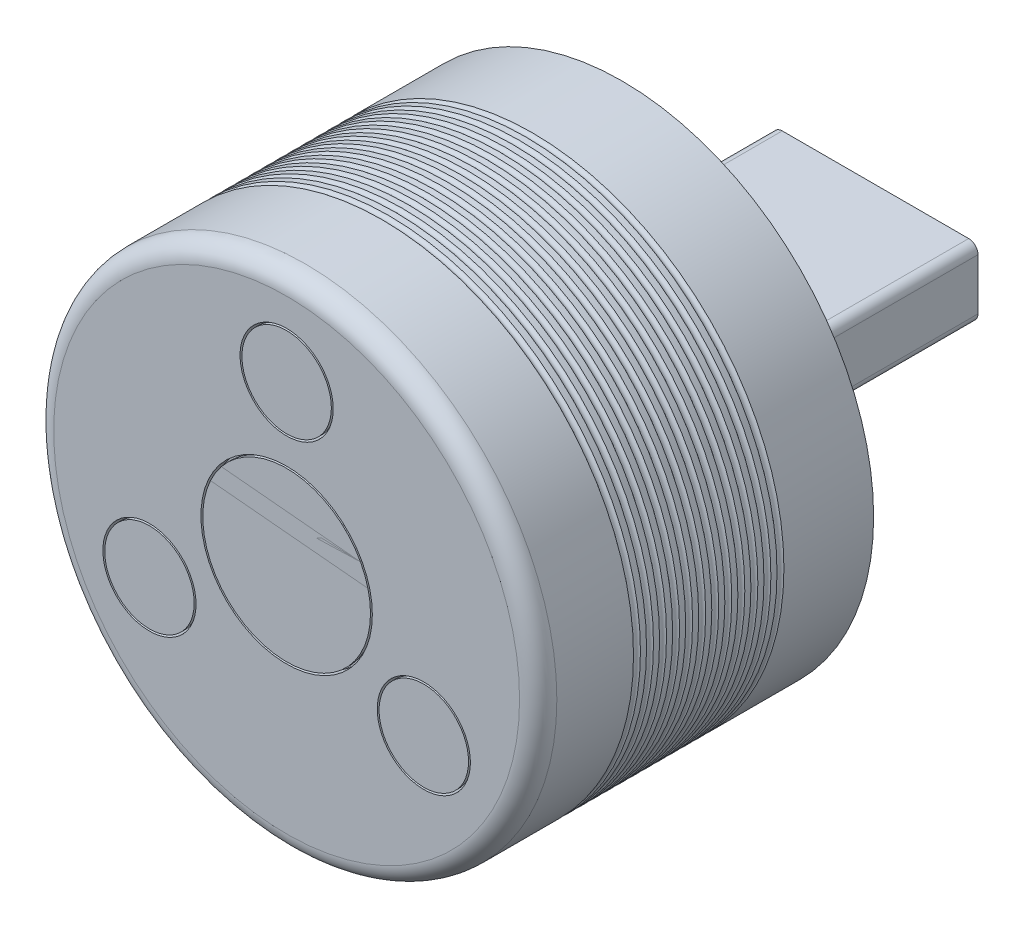
from build123d import *

# Parameters (mm, degrees)
FRONT_COVER_DEPTH                              = 15
FRONT_COVER_DEPTH_BACK                         = 3
SKETCH1_R                                      = 13.5
SKETCH2_R                                      = 2.5
ECG_HOLES_DEPTH                                = 2
SKETCH2_4_R                                    = 4.6
PRESSURE_SENSOR_HOLE_DEPTH                     = 0.5
FILLET_FRONT_COVER_R                           = 1
SHELL_START                                    = -3
SHELL_FRONT_COVER_OUTLINE_R                    = 12.5
SHELL_FRONT_COVER_OUTLINE_R_2                  = 3
SHELL_FRONT_COVER_DEPTH                        = 14.837411557
SHELL_START_2                                  = 9.598878162
SHELL_FRONT_COVER_2_OUTLINE_R                  = 12.5
SHELL_FRONT_COVER_2_DEPTH                      = 4.401121838
SHELL_FRONT_COVER_3_OUTLINE_R                  = 3
SHELL_FRONT_COVER_3_DEPTH                      = 12.598878162
SHELL_FRONT_COVER_4_OUTLINE_R                  = 3.5
SHELL_FRONT_COVER_4_DEPTH                      = 2.401121838
SHELL_START_3                                  = 11.837411557
SHELL_FRONT_COVER_5_DEPTH                      = 1.662588443
HOLES_ECG_WIRES_REACH                          = 26.91
SKETCH4_R                                      = 0.75
HOLE_PRESSURE_SENSOR_FPC_REACH                 = 27.899
SKETCH5_W                                      = 5.8
SKETCH5_H                                      = 0.5
HOLE_MIC_PINS_REACH                            = 25.44
SKETCH17_R                                     = 13.05
FRONT_COVER_FIX_STRUCTURE_DEPTH                = 1.1
SKETCH7_R                                      = 13
BACK_COVER_DEPTH                               = 1
SKETCH8_W                                      = 11
SKETCH8_H                                      = 3.75
USB_HOLE_BACK_COVER_DEPTH                      = 1
SKETCH9_R                                      = 0.2
SKETCH12_R                                     = 2.4
MOCK_FILM_SENSORS_DEPTH                        = 0.2
MOCK_FILM_SENSORS_2_DEPTH                      = 0.2
MOCK_FILM_SENSORS_3_DEPTH                      = 0.2
SKETCH12_R_2                                   = 4.5
MOCK_FILM_SENSORS_4_DEPTH                      = 0.2
SKETCH13_R                                     = 2
FRONT_COVER_SCREWS_PILLARS_DEPTH               = 14
SCREWS_PILLARS_RIBS_REACH                      = 30.767
SKETCH16_WALL_W                                = 63.534087048
SKETCH16_WALL_H                                = 1
CIRPATTERN1_COUNT                              = 4
CIRPATTERN2_COUNT                              = 3
CIRPATTERN2_COPY_1_REACH                       = 30.767
CIRPATTERN2_COPY_1_SKETCH_W                    = 63.534087048
CIRPATTERN2_COPY_1_SKETCH_H                    = 1
CIRPATTERN2_COPY_2_REACH                       = 30.767
CIRPATTERN2_COPY_2_SKETCH_W                    = 63.534087048
CIRPATTERN2_COPY_2_SKETCH_H                    = 1
CIRPATTERN2_COPY_3_REACH                       = 30.767
CIRPATTERN2_COPY_3_SKETCH_W                    = 63.534087048
CIRPATTERN2_COPY_3_SKETCH_H                    = 1
CIRPATTERN2_COPY_4_REACH                       = 30.767
CIRPATTERN2_COPY_4_SKETCH_W                    = 63.534087048
CIRPATTERN2_COPY_4_SKETCH_H                    = 1
CIRPATTERN2_COPY_5_REACH                       = 30.767
CIRPATTERN2_COPY_5_SKETCH_W                    = 63.534087048
CIRPATTERN2_COPY_5_SKETCH_H                    = 1
CIRPATTERN2_COPY_6_REACH                       = 30.767
CIRPATTERN2_COPY_6_SKETCH_W                    = 63.534087048
CIRPATTERN2_COPY_6_SKETCH_H                    = 1
SKETCH18_R                                     = 3
USB_BASE_DEPTH                                 = 4.1
BACK_START                                     = 4.1
SKETCH18_3_R                                   = 2.1
BACK_COVER_SCREWS_FEMALE_PILLARS_DEPTH         = 2.2
SKETCH23_R                                     = 0.3
SKETCH23_W                                     = 1.9
SKETCH23_H                                     = 1.5
BACK_COVER_SCREWS_FEMALE_PILLARS_FIX_HOL_DEPTH = 0.7
USB_START                                      = 11
SKETCH23_2_R                                   = 0.3
SKETCH23_2_W                                   = 1.9
SKETCH23_2_H                                   = 1.5
USB_FIX_STRUCTURE_BACK_COVER_DEPTH             = 0.7
FILLET_USB_FIX_R                               = 0.2
BACK_COVER_SCREWS_FEMALE_PILLARS_SCR_2_COUNT   = 2
BACK_COVER_SCREWS_FEMALE_PILLARS_SCR_2_PITCH   = 15.159615379
BACK_COVER_SCREWS_FEMALE_PILLARS_SCR_3_COUNT   = 2
BACK_COVER_SCREWS_FEMALE_PILLARS_SCR_3_PITCH   = 15.159615379
MOCK_USB_METAL_DEPTH                           = 13.6
SKETCH26_R                                     = 4.5
BOSS_EXTRUDE11_DEPTH                           = 0.2
SKETCH27_W                                     = 8
SKETCH27_H                                     = 1
MOCK_USB_STICK_DEPTH                           = 14.6
SKETCH28_W                                     = 1
SKETCH28_H                                     = 0.1
MOCK_USB_PINS_DEPTH                            = 10
MOCK_USB_PINS_2_DEPTH                          = 10
MOCK_USB_PINS_3_DEPTH                          = 10
MOCK_USB_PINS_4_DEPTH                          = 10
MOCK_USB_PINS_5_DEPTH                          = 10
MOCK_USB_PINS_6_DEPTH                          = 10
MOCK_USB_PINS_7_DEPTH                          = 10
MOCK_USB_PINS_8_DEPTH                          = 10
MOCK_USB_PINS_9_DEPTH                          = 10


with BuildPart() as part:
    # Sketch1 → front cover (new, two sides: drawn at the far end of the back side and taken through both)
    with BuildSketch(Plane.XY.offset(-FRONT_COVER_DEPTH_BACK)):
        Circle(SKETCH1_R)
    extrude(amount=FRONT_COVER_DEPTH + FRONT_COVER_DEPTH_BACK)

    # Sketch2 → ECG holes (cut)
    with BuildSketch(Plane.XY.offset(15)):
        with Locations((7.361215932, -4.25)):
            Circle(SKETCH2_R)
        with Locations((0, 8.5)):
            Circle(SKETCH2_R)
        with Locations((-7.361215932, -4.25)):
            Circle(SKETCH2_R)
    extrude(amount=-ECG_HOLES_DEPTH, mode=Mode.SUBTRACT)

    # Sketch2<4> → pressure sensor hole (cut)
    with BuildSketch(Plane.XY.offset(15)):
        Circle(SKETCH2_4_R)
    extrude(amount=-PRESSURE_SENSOR_HOLE_DEPTH, mode=Mode.SUBTRACT)

    # Sketch3 → cavity mic (revolve, cut)
    with BuildSketch(Plane(origin=(0, 0, 0), x_dir=(1, 0, 0), z_dir=(0, 1, 0))):
        with BuildLine():
            Line((0, -10.598878162), (0, -14.503714756))
            Line((0, -14.503714756), (2.7, -14.501534356))
            ThreePointArc((2.7, -14.501534356), (2.502749431, -13.255703595), (2, -12.098878162))
            Line((2, -12.098878162), (2, -10.598878162))
            Line((2, -10.598878162), (0, -10.598878162))
        make_face()
    revolve(axis=Axis((0, 0, 10.598878162), (0, 0, 1)), mode=Mode.SUBTRACT)

    # fillet front cover
    fillet_front_cover_edges = [part.edges().sort_by_distance(p)[0] for p in [
        (-13.5, 0, 15),
    ]]
    fillet(fillet_front_cover_edges, radius=FILLET_FRONT_COVER_R)

    # Shell front cover: read off the stored shape, not the designer's step
    # Shell front cover outline → Shell front cover (cut)
    with BuildSketch(Plane.XY.offset(SHELL_START)):
        Circle(SHELL_FRONT_COVER_OUTLINE_R)
        Circle(SHELL_FRONT_COVER_OUTLINE_R_2, mode=Mode.SUBTRACT)
    extrude(amount=SHELL_FRONT_COVER_DEPTH, mode=Mode.SUBTRACT)

    # Shell front cover 2 outline → Shell front cover 2 (cut)
    with BuildSketch(Plane.XY.offset(SHELL_START_2)):
        Circle(SHELL_FRONT_COVER_2_OUTLINE_R)
        with BuildLine():
            ThreePointArc((5.44134212, -1.323554281), (10.392304845, -6), (3.866902691, -4.050563366))
            ThreePointArc((3.866902691, -4.050563366), (0, -5.6), (-3.866902691, -4.050563366))
            ThreePointArc((-3.866902691, -4.050563366), (-10.392304845, -6), (-5.44134212, -1.323554281))
            ThreePointArc((-5.44134212, -1.323554281), (-4.849742261, 2.8), (-1.574439429, 5.374117647))
            ThreePointArc((-1.574439429, 5.374117647), (0, 12), (1.574439429, 5.374117647))
            ThreePointArc((1.574439429, 5.374117647), (4.849742261, 2.8), (5.44134212, -1.323554281))
        make_face(mode=Mode.SUBTRACT)
    extrude(amount=SHELL_FRONT_COVER_2_DEPTH, mode=Mode.SUBTRACT)

    # Shell front cover 3 outline → Shell front cover 3 (cut)
    with BuildSketch(Plane.XY.offset(SHELL_START)):
        Circle(SHELL_FRONT_COVER_3_OUTLINE_R)
    extrude(amount=SHELL_FRONT_COVER_3_DEPTH, mode=Mode.SUBTRACT)

    # Shell front cover 4 outline → Shell front cover 4 (cut)
    with BuildSketch(Plane.XY.offset(SHELL_START_2)):
        with Locations((7.361215932, -4.25)):
            Circle(SHELL_FRONT_COVER_4_OUTLINE_R)
        with Locations((0, 8.5)):
            Circle(SHELL_FRONT_COVER_4_OUTLINE_R)
        with Locations((-7.361215932, -4.25)):
            Circle(SHELL_FRONT_COVER_4_OUTLINE_R)
    extrude(amount=SHELL_FRONT_COVER_4_DEPTH, mode=Mode.SUBTRACT)

    # Shell front cover 5 outline → Shell front cover 5 (cut)
    with BuildSketch(Plane.XY.offset(SHELL_START_3)):
        with BuildLine():
            ThreePointArc((-5.44134212, -1.323554281), (-4.330127019, -2.5), (-3.866902691, -4.050563366))
            ThreePointArc((-3.866902691, -4.050563366), (0, -5.6), (3.866902691, -4.050563366))
            ThreePointArc((3.866902691, -4.050563366), (4.330127019, -2.5), (5.44134212, -1.323554281))
            ThreePointArc((5.44134212, -1.323554281), (4.849742261, 2.8), (1.574439429, 5.374117647))
            ThreePointArc((1.574439429, 5.374117647), (0, 5), (-1.574439429, 5.374117647))
            ThreePointArc((-1.574439429, 5.374117647), (-4.849742261, 2.8), (-5.44134212, -1.323554281))
        make_face()
    extrude(amount=SHELL_FRONT_COVER_5_DEPTH, mode=Mode.SUBTRACT)

    # Shell front cover 6 outline → Shell front cover 6 (revolve)
    with BuildSketch(Plane.XZ):
        with BuildLine():
            ThreePointArc((2.567273922, 13.5), (2.336891409, 12.777877887), (2, 12.098878162))
            Line((2, 12.098878162), (2, 11.837411557))
            Line((2, 11.837411557), (3, 11.837411657))
            ThreePointArc((3, 11.837411657), (3.35657147, 12.646892192), (3.590257197, 13.5))
            Line((3.590257197, 13.5), (2.567273922, 13.5))
        make_face()
    revolve(axis=Axis((0, 0, 0), (0, 0, 1)))

    # Sketch4 → holes ECG wires (cut, up to next)
    with BuildSketch(Plane.XY.offset(13), mode=Mode.PRIVATE) as holes_ecg_wires_sk1:
        with Locations((0, 8.5)):
            Circle(SKETCH4_R)
    holes_ecg_wires_tool1 = extrude(holes_ecg_wires_sk1.sketch, amount=-HOLES_ECG_WIRES_REACH, mode=Mode.PRIVATE) & part.part
    # Sketch4 → holes ECG wires (cut, up to next)
    with BuildSketch(Plane.XY.offset(13), mode=Mode.PRIVATE) as holes_ecg_wires_sk2:
        with Locations((7.361215932, -4.25)):
            Circle(SKETCH4_R)
    holes_ecg_wires_tool2 = extrude(holes_ecg_wires_sk2.sketch, amount=-HOLES_ECG_WIRES_REACH, mode=Mode.PRIVATE) & part.part
    # Sketch4 → holes ECG wires (cut, up to next)
    with BuildSketch(Plane.XY.offset(13), mode=Mode.PRIVATE) as holes_ecg_wires_sk3:
        with Locations((-7.361215932, -4.25)):
            Circle(SKETCH4_R)
    holes_ecg_wires_tool3 = extrude(holes_ecg_wires_sk3.sketch, amount=-HOLES_ECG_WIRES_REACH, mode=Mode.PRIVATE) & part.part
    add(holes_ecg_wires_tool1.solids().sort_by_distance((0, 8.5, 13))[0], mode=Mode.SUBTRACT)
    add(holes_ecg_wires_tool2.solids().sort_by_distance((7.361216, -4.25, 13))[0], mode=Mode.SUBTRACT)
    add(holes_ecg_wires_tool3.solids().sort_by_distance((-7.361216, -4.25, 13))[0], mode=Mode.SUBTRACT)

    # Sketch5 → hole pressure sensor fpc (cut, up to next)
    with BuildSketch(Plane.XY.offset(14.5), mode=Mode.PRIVATE) as hole_pressure_sensor_fpc_sk1:
        with Locations((0, -3.35)):
            Rectangle(SKETCH5_W, SKETCH5_H)
    hole_pressure_sensor_fpc_tool1 = extrude(hole_pressure_sensor_fpc_sk1.sketch, amount=-HOLE_PRESSURE_SENSOR_FPC_REACH, mode=Mode.PRIVATE) & part.part
    add(hole_pressure_sensor_fpc_tool1.solids().sort_by_distance((0, -3.35, 14.5))[0], mode=Mode.SUBTRACT)

    # Sketch6 → hole mic pins (cut, up to next)
    with BuildSketch(Plane.XY.offset(10.598878162), mode=Mode.PRIVATE) as hole_mic_pins_sk1:
        with BuildLine():
            Line((-0.4, 0.8), (0.4, 0.8))
            ThreePointArc((0.4, 0.8), (0.8, 0.4), (0.4, 0))
            Line((0.4, 0), (-0.4, 0))
            ThreePointArc((-0.4, 0), (-0.8, 0.4), (-0.4, 0.8))
        make_face()
    hole_mic_pins_tool1 = extrude(hole_mic_pins_sk1.sketch, amount=-HOLE_MIC_PINS_REACH, mode=Mode.PRIVATE) & part.part
    add(hole_mic_pins_tool1.solids().sort_by_distance((0, 0.4, 10.598878))[0], mode=Mode.SUBTRACT)

    # Sketch17 → front cover fix structure (cut)
    with BuildSketch(Plane(origin=(0, 0, -3), x_dir=(-1, 0, 0), z_dir=(0, 0, -1))):
        Circle(SKETCH17_R)
    extrude(amount=-FRONT_COVER_FIX_STRUCTURE_DEPTH, mode=Mode.SUBTRACT)

    # Sketch9 → texture front cover (revolve, cut)
    with BuildSketch(Plane(origin=(0, 0, 0), x_dir=(1, 0, 0), z_dir=(0, 1, 0))):
        with Locations((13.574057568, -2)):
            Circle(SKETCH9_R)
        with Locations((13.574057568, -2.7)):
            Circle(SKETCH9_R)
        with Locations((13.574057568, -3.4)):
            Circle(SKETCH9_R)
        with Locations((13.574057568, -4.1)):
            Circle(SKETCH9_R)
        with Locations((13.574057568, -4.8)):
            Circle(SKETCH9_R)
        with Locations((13.574057568, -5.5)):
            Circle(SKETCH9_R)
        with Locations((13.574057568, -6.2)):
            Circle(SKETCH9_R)
        with Locations((13.574057568, -6.9)):
            Circle(SKETCH9_R)
        with Locations((13.574057568, -7.6)):
            Circle(SKETCH9_R)
        with Locations((13.574057568, -8.3)):
            Circle(SKETCH9_R)
        with Locations((13.574057568, -9)):
            Circle(SKETCH9_R)
        with Locations((13.574057568, -9.7)):
            Circle(SKETCH9_R)
    revolve(axis=Axis((0, 0, 0), (0, 0, 1)), mode=Mode.SUBTRACT)

    # Sketch13 → front cover screws pillars (add)
    with BuildSketch(Plane(origin=(0, 0, 14), x_dir=(-1, 0, 0), z_dir=(0, 0, -1))):
        with Locations(Location((7.579807689, 4.37620401, 0), (0, 0, 180))):
            Circle(SKETCH13_R)
        with Locations(Location((0, -8.75240802, 0), (0, 0, 180))):
            Circle(SKETCH13_R)
        with Locations(Location((-7.579807689, 4.37620401, 0), (0, 0, 180))):
            Circle(SKETCH13_R)
    extrude(amount=FRONT_COVER_SCREWS_PILLARS_DEPTH)

    # Sketch16 wall → screws pillars ribs (add, up to next)
    with BuildSketch(Plane(origin=(-8.438625211, 7.250648733, 12.267949192), x_dir=(0.143136253521, -0.479074120322, -0.86602540388), z_dir=(0.247919263737, -0.829780717319, 0.499999999834)), mode=Mode.PRIVATE) as screws_pillars_ribs_sk1:
        Rectangle(SKETCH16_WALL_W, SKETCH16_WALL_H)
    screws_pillars_ribs_tool1 = extrude(screws_pillars_ribs_sk1.sketch, amount=SCREWS_PILLARS_RIBS_REACH, mode=Mode.PRIVATE) - part.part
    screws_pillars_ribs = screws_pillars_ribs_tool1.solids().sort_by_distance((-8.438625211, 7.250648733, 12.267949192))[0]
    add(screws_pillars_ribs)

    # CirPattern1: screws pillars ribs ×4 about axis
    cirpattern1_axis = Axis((-7.579807689, 4.37620401, 0), (0, 0, 1))
    for i in range(1, CIRPATTERN1_COUNT):
        add(screws_pillars_ribs.rotate(cirpattern1_axis, i * 360 / CIRPATTERN1_COUNT))

    # CirPattern2: screws pillars ribs ×3 about axis
    cirpattern2_axis = Axis((0, 0, 0), (0, 0, 1))
    for i in range(1, CIRPATTERN2_COUNT):
        add(screws_pillars_ribs.rotate(cirpattern2_axis, i * 360 / CIRPATTERN2_COUNT))

    # CirPattern2 copy 1 sketch → CirPattern2 copy 1 (add, up to next)
    with BuildSketch(Plane(origin=(2.180980153, -10.812341411, 12.267949192), x_dir=(-0.36349669191271566, 0.34332223173403487, -0.86602540388), z_dir=(-0.6295947391432759, 0.5946515489002283, 0.499999999834)), mode=Mode.PRIVATE) as cirpattern2_copy_1_sk1:
        Rectangle(CIRPATTERN2_COPY_1_SKETCH_W, CIRPATTERN2_COPY_1_SKETCH_H)
    cirpattern2_copy_1_tool1 = extrude(cirpattern2_copy_1_sk1.sketch, amount=CIRPATTERN2_COPY_1_REACH, mode=Mode.PRIVATE) - part.part
    add(cirpattern2_copy_1_tool1.solids().sort_by_distance((2.180980153, -10.812341411, 12.267949192))[0])

    # CirPattern2 copy 2 sketch → CirPattern2 copy 2 (add, up to next)
    with BuildSketch(Plane(origin=(8.27327226, 7.294954923, 12.267949192), x_dir=(-0.11557742840928444, -0.4864584852550347, -0.86602540388), z_dir=(-0.20018597817572434, -0.8425708126372281, 0.499999999834)), mode=Mode.PRIVATE) as cirpattern2_copy_2_sk1:
        Rectangle(CIRPATTERN2_COPY_2_SKETCH_W, CIRPATTERN2_COPY_2_SKETCH_H)
    cirpattern2_copy_2_tool1 = extrude(cirpattern2_copy_2_sk1.sketch, amount=CIRPATTERN2_COPY_2_REACH, mode=Mode.PRIVATE) - part.part
    add(cirpattern2_copy_2_tool1.solids().sort_by_distance((8.27327226, 7.294954923, 12.267949192))[0])

    # CirPattern2 copy 3 sketch → CirPattern2 copy 3 (add, up to next)
    with BuildSketch(Plane(origin=(2.059933391, -6.571427867, 12.267949192), x_dir=(-0.3433222317340349, -0.36349669191271566, -0.86602540388), z_dir=(-0.5946515489002284, -0.6295947391432759, 0.499999999834)), mode=Mode.PRIVATE) as cirpattern2_copy_3_sk1:
        Rectangle(CIRPATTERN2_COPY_3_SKETCH_W, CIRPATTERN2_COPY_3_SKETCH_H)
    cirpattern2_copy_3_tool1 = extrude(cirpattern2_copy_3_sk1.sketch, amount=CIRPATTERN2_COPY_3_REACH, mode=Mode.PRIVATE) - part.part
    add(cirpattern2_copy_3_tool1.solids().sort_by_distance((2.059933391, -6.571427867, 12.267949192))[0])

    # CirPattern2 copy 4 sketch → CirPattern2 copy 4 (add, up to next)
    with BuildSketch(Plane(origin=(4.661056776, 5.06966858, 12.267949192), x_dir=(0.48645848525503466, -0.1155774284092845, -0.86602540388), z_dir=(0.842570812637228, -0.20018597817572442, 0.499999999834)), mode=Mode.PRIVATE) as cirpattern2_copy_4_sk1:
        Rectangle(CIRPATTERN2_COPY_4_SKETCH_W, CIRPATTERN2_COPY_4_SKETCH_H)
    cirpattern2_copy_4_tool1 = extrude(cirpattern2_copy_4_sk1.sketch, amount=CIRPATTERN2_COPY_4_REACH, mode=Mode.PRIVATE) - part.part
    add(cirpattern2_copy_4_tool1.solids().sort_by_distance((4.661056776, 5.06966858, 12.267949192))[0])

    # CirPattern2 copy 5 sketch → CirPattern2 copy 5 (add, up to next)
    with BuildSketch(Plane(origin=(-2.180980153, -6.692474628, 12.267949192), x_dir=(0.3634966919127156, -0.3433222317340349, -0.86602540388), z_dir=(0.6295947391432759, -0.5946515489002284, 0.499999999834)), mode=Mode.PRIVATE) as cirpattern2_copy_5_sk1:
        Rectangle(CIRPATTERN2_COPY_5_SKETCH_W, CIRPATTERN2_COPY_5_SKETCH_H)
    cirpattern2_copy_5_tool1 = extrude(cirpattern2_copy_5_sk1.sketch, amount=CIRPATTERN2_COPY_5_REACH, mode=Mode.PRIVATE) - part.part
    add(cirpattern2_copy_5_tool1.solids().sort_by_distance((-2.180980153, -6.692474628, 12.267949192))[0])

    # CirPattern2 copy 6 sketch → CirPattern2 copy 6 (add, up to next)
    with BuildSketch(Plane(origin=(6.886343119, 1.457453097, 12.267949192), x_dir=(0.1155774284092845, 0.48645848525503466, -0.86602540388), z_dir=(0.20018597817572442, 0.842570812637228, 0.499999999834)), mode=Mode.PRIVATE) as cirpattern2_copy_6_sk1:
        Rectangle(CIRPATTERN2_COPY_6_SKETCH_W, CIRPATTERN2_COPY_6_SKETCH_H)
    cirpattern2_copy_6_tool1 = extrude(cirpattern2_copy_6_sk1.sketch, amount=CIRPATTERN2_COPY_6_REACH, mode=Mode.PRIVATE) - part.part
    add(cirpattern2_copy_6_tool1.solids().sort_by_distance((6.886343119, 1.457453097, 12.267949192))[0])


with BuildPart() as body_2:
    # Sketch7 → back cover (new body)
    with BuildSketch(Plane.XY.offset(-3)):
        Circle(SKETCH7_R)
    extrude(amount=BACK_COVER_DEPTH)

    # Sketch8 → usb hole back cover (cut)
    with BuildSketch(Plane(origin=(0, 0, -3), x_dir=(-1, 0, 0), z_dir=(0, 0, -1))):
        Rectangle(SKETCH8_W, SKETCH8_H)
    extrude(amount=-USB_HOLE_BACK_COVER_DEPTH, mode=Mode.SUBTRACT)

    # Sketch18 → usb base (add)
    with BuildSketch(Plane.XY.offset(-2)):
        Polygon((5.5, 1.875), (6.4, 1.875), (6.4, -2.775), (-6.4, -2.775), (-6.4, 1.875), (-5.5, 1.875), (-5.5, -1.875), (5.5, -1.875), align=None)
        with Locations((-7.579807689, 4.37620401)):
            Circle(SKETCH18_R)
        with Locations((7.579807689, 4.37620401)):
            Circle(SKETCH18_R)
        with Locations((0, -8.75240802)):
            Circle(SKETCH18_R)
    extrude(amount=USB_BASE_DEPTH)

    # Sketch18<3> → back cover screws female pillars (cut)
    with BuildSketch(Plane.XY.offset(-2).offset(BACK_START)):
        with Locations((-7.579807689, 4.37620401)):
            Circle(SKETCH18_3_R)
        with Locations((7.579807689, 4.37620401)):
            Circle(SKETCH18_3_R)
        with Locations((0, -8.75240802)):
            Circle(SKETCH18_3_R)
    extrude(amount=-BACK_COVER_SCREWS_FEMALE_PILLARS_DEPTH, mode=Mode.SUBTRACT)

    # Sketch23 → back cover screws female pillars fix hol (add)
    with BuildSketch(Plane(origin=(-5.5, 0, 0), x_dir=(0, 0, -1), z_dir=(1, 0, 0))):
        with Locations(Location((-1.1, 1.225, 0), (0, 0, 270))):
            Circle(SKETCH23_R)
        with Locations((1.05, 0.775)):
            Rectangle(SKETCH23_W, SKETCH23_H)
    extrude(amount=BACK_COVER_SCREWS_FEMALE_PILLARS_FIX_HOL_DEPTH)

    # Sketch23<2> → usb fix structure back cover (add)
    with BuildSketch(Plane(origin=(-5.5, 0, 0), x_dir=(0, 0, -1), z_dir=(1, 0, 0)).offset(USB_START)):
        with Locations(Location((-1.1, 1.225, 0), (0, 0, 270))):
            Circle(SKETCH23_2_R)
        with Locations((1.05, 0.775)):
            Rectangle(SKETCH23_2_W, SKETCH23_2_H)
    extrude(amount=-USB_FIX_STRUCTURE_BACK_COVER_DEPTH)

    # Fillet usb fix
    fillet_usb_fix_edges = [body_2.edges().sort_by_distance(p)[0] for p in [
        (-4.8, 1.525, 1.1),
        (-4.8, 0.775, -0.1),
        (-4.8, 0.025, -1.05),
        (-4.8, 0.775, -2),
        (-4.8, 1.525, -1.05),
        (4.8, 1.525, 1.1),
        (4.8, 0.025, -1.05),
        (4.8, 0.775, -0.1),
        (4.8, 1.525, -1.05),
        (4.8, 0.775, -2),
    ]]
    fillet(fillet_usb_fix_edges, radius=FILLET_USB_FIX_R)


with BuildPart() as body_3:
    # Sketch12 → mock film sensors (new body)
    with BuildSketch(Plane.XY.offset(15)):
        with Locations((0, 8.5)):
            Circle(SKETCH12_R)
    extrude(amount=-MOCK_FILM_SENSORS_DEPTH)


with BuildPart() as body_4:
    # Sketch12 → mock film sensors 2 (new body)
    with BuildSketch(Plane.XY.offset(15)):
        with Locations((-7.361215932, -4.25)):
            Circle(SKETCH12_R)
    extrude(amount=-MOCK_FILM_SENSORS_2_DEPTH)


with BuildPart() as body_5:
    # Sketch12 → mock film sensors 3 (new body)
    with BuildSketch(Plane.XY.offset(15)):
        with Locations((7.361215932, -4.25)):
            Circle(SKETCH12_R)
    extrude(amount=-MOCK_FILM_SENSORS_3_DEPTH)


with BuildPart() as body_6:
    # Sketch12 → mock film sensors 4 (new body)
    with BuildSketch(Plane.XY.offset(15)):
        Circle(SKETCH12_R_2)
    extrude(amount=-MOCK_FILM_SENSORS_4_DEPTH)


with BuildPart() as back_cover_screws_female_pillars_screw_h_tool:
    # Sketch22 → back cover screws female pillars screw h (revolve)
    with BuildSketch(Plane(origin=(-7.579807689, 4.37620401, -3), x_dir=(0, 1, 0), z_dir=(1, 0, 0))):
        Polygon((0, 0), (0, 5.540774557), (0.9, 5), (0.9, 1), (2.1, 1), (2.1, 0), align=None)
    back_cover_screws_female_pillars_screw_h = revolve(axis=Axis((-7.579807689, 4.37620401, -9.35), (0, 0, 1)))


with BuildPart() as part_1:
    add(part.part)

    # back cover screws female pillars screw h: cut by back_cover_screws_female_pillars_screw_h_tool
    add(back_cover_screws_female_pillars_screw_h_tool.part, mode=Mode.SUBTRACT)


with BuildPart() as body_2_1:
    add(body_2.part)

    # back cover screws female pillars screw h: cut by back_cover_screws_female_pillars_screw_h_tool
    add(back_cover_screws_female_pillars_screw_h_tool.part, mode=Mode.SUBTRACT)


with BuildPart() as back_cover_screws_female_pillars_scr_2_tool:
    # back cover screws female pillars scr 2: back cover screws female pillars screw h ×2
    with Locations(*[Vector(0.49999999999998973, -0.8660254037844446, 0) * (i * BACK_COVER_SCREWS_FEMALE_PILLARS_SCR_2_PITCH) for i in range(1, BACK_COVER_SCREWS_FEMALE_PILLARS_SCR_2_COUNT)]):
        add(back_cover_screws_female_pillars_screw_h)


with BuildPart() as part_2:
    add(part_1.part)

    # back cover screws female pillars scr 2: cut by back_cover_screws_female_pillars_scr_2_tool
    add(back_cover_screws_female_pillars_scr_2_tool.part, mode=Mode.SUBTRACT)


with BuildPart() as body_2_2:
    add(body_2_1.part)

    # back cover screws female pillars scr 2: cut by back_cover_screws_female_pillars_scr_2_tool
    add(back_cover_screws_female_pillars_scr_2_tool.part, mode=Mode.SUBTRACT)


with BuildPart() as back_cover_screws_female_pillars_scr_3_tool:
    # back cover screws female pillars scr 3: back cover screws female pillars screw h ×2
    with Locations(*[(i * BACK_COVER_SCREWS_FEMALE_PILLARS_SCR_3_PITCH, 0, 0) for i in range(1, BACK_COVER_SCREWS_FEMALE_PILLARS_SCR_3_COUNT)]):
        add(back_cover_screws_female_pillars_screw_h)


with BuildPart() as part_3:
    add(part_2.part)

    # back cover screws female pillars scr 3: cut by back_cover_screws_female_pillars_scr_3_tool
    add(back_cover_screws_female_pillars_scr_3_tool.part, mode=Mode.SUBTRACT)


with BuildPart() as body_2_3:
    add(body_2_2.part)

    # back cover screws female pillars scr 3: cut by back_cover_screws_female_pillars_scr_3_tool
    add(back_cover_screws_female_pillars_scr_3_tool.part, mode=Mode.SUBTRACT)


with BuildPart() as body_7:
    # Sketch24 → mock usb metal (new body)
    with BuildSketch(Plane(origin=(0, 0, -3), x_dir=(-1, 0, 0), z_dir=(0, 0, -1))):
        with BuildLine():
            Line((-4.999894815, 1.875), (5.004271379, 1.875))
            ThreePointArc((5.004271379, 1.875), (5.35782477, 1.728553391), (5.504271379, 1.375))
            Line((5.504271379, 1.375), (5.504271379, -1.375))
            ThreePointArc((5.504271379, -1.375), (5.35782477, -1.728553391), (5.004271379, -1.875))
            Line((5.004271379, -1.875), (-4.999894815, -1.875))
            ThreePointArc((-4.999894815, -1.875), (-5.353448206, -1.728553391), (-5.499894815, -1.375))
            Line((-5.499894815, -1.375), (-5.499894815, 1.375))
            ThreePointArc((-5.499894815, 1.375), (-5.353448206, 1.728553391), (-4.999894815, 1.875))
        make_face()
        with BuildLine():
            Line((-5.299894815, 1.375), (-5.299894815, -1.375))
            ThreePointArc((-5.299894815, -1.375), (-5.21202685, -1.587132034), (-4.999894815, -1.675))
            Line((-4.999894815, -1.675), (5.004271379, -1.675))
            ThreePointArc((5.004271379, -1.675), (5.216403413, -1.587132034), (5.304271379, -1.375))
            Line((5.304271379, -1.375), (5.304271379, 1.375))
            ThreePointArc((5.304271379, 1.375), (5.216403413, 1.587132034), (5.004271379, 1.675))
            Line((5.004271379, 1.675), (-4.999894815, 1.675))
            ThreePointArc((-4.999894815, 1.675), (-5.21202685, 1.587132034), (-5.299894815, 1.375))
        make_face(mode=Mode.SUBTRACT)
    extrude(amount=MOCK_USB_METAL_DEPTH)


with BuildPart() as body_8:
    # Sketch26 → Boss-Extrude11 (new body)
    with BuildSketch(Plane.XY.offset(15)):
        Circle(SKETCH26_R)
    extrude(amount=-BOSS_EXTRUDE11_DEPTH)


with BuildPart() as body_9:
    # Sketch27 → mock usb stick (new body)
    with BuildSketch(Plane(origin=(0, 0, -16.6), x_dir=(-1, 0, 0), z_dir=(0, 0, -1))):
        Rectangle(SKETCH27_W, SKETCH27_H)
    extrude(amount=-MOCK_USB_STICK_DEPTH)


with BuildPart() as body_10:
    # Sketch28 → mock usb pins (new body)
    with BuildSketch(Plane(origin=(0, 0, -16.6), x_dir=(-1, 0, 0), z_dir=(0, 0, -1))):
        with Locations((0, 0.55)):
            Rectangle(SKETCH28_W, SKETCH28_H)
    extrude(amount=-MOCK_USB_PINS_DEPTH)


with BuildPart() as body_11:
    # Sketch28 → mock usb pins 2 (new body)
    with BuildSketch(Plane(origin=(0, 0, -16.6), x_dir=(-1, 0, 0), z_dir=(0, 0, -1))):
        with Locations((1.5, 0.55)):
            Rectangle(SKETCH28_W, SKETCH28_H)
    extrude(amount=-MOCK_USB_PINS_2_DEPTH)


with BuildPart() as body_12:
    # Sketch28 → mock usb pins 3 (new body)
    with BuildSketch(Plane(origin=(0, 0, -16.6), x_dir=(-1, 0, 0), z_dir=(0, 0, -1))):
        with Locations((3, 0.55)):
            Rectangle(SKETCH28_W, SKETCH28_H)
    extrude(amount=-MOCK_USB_PINS_3_DEPTH)


with BuildPart() as body_13:
    # Sketch28 → mock usb pins 4 (new body)
    with BuildSketch(Plane(origin=(0, 0, -16.6), x_dir=(-1, 0, 0), z_dir=(0, 0, -1))):
        with Locations((-1.5, 0.55)):
            Rectangle(SKETCH28_W, SKETCH28_H)
    extrude(amount=-MOCK_USB_PINS_4_DEPTH)


with BuildPart() as body_14:
    # Sketch28 → mock usb pins 5 (new body)
    with BuildSketch(Plane(origin=(0, 0, -16.6), x_dir=(-1, 0, 0), z_dir=(0, 0, -1))):
        with Locations((-3, 0.55)):
            Rectangle(SKETCH28_W, SKETCH28_H)
    extrude(amount=-MOCK_USB_PINS_5_DEPTH)


with BuildPart() as body_15:
    # Sketch28 → mock usb pins 6 (new body)
    with BuildSketch(Plane(origin=(0, 0, -16.6), x_dir=(-1, 0, 0), z_dir=(0, 0, -1))):
        with Locations((-0.766911849, -0.55)):
            Rectangle(SKETCH28_W, SKETCH28_H)
    extrude(amount=-MOCK_USB_PINS_6_DEPTH)


with BuildPart() as body_16:
    # Sketch28 → mock usb pins 7 (new body)
    with BuildSketch(Plane(origin=(0, 0, -16.6), x_dir=(-1, 0, 0), z_dir=(0, 0, -1))):
        with Locations((-2.266911849, -0.55)):
            Rectangle(SKETCH28_W, SKETCH28_H)
    extrude(amount=-MOCK_USB_PINS_7_DEPTH)


with BuildPart() as body_17:
    # Sketch28 → mock usb pins 8 (new body)
    with BuildSketch(Plane(origin=(0, 0, -16.6), x_dir=(-1, 0, 0), z_dir=(0, 0, -1))):
        with Locations((0.733088151, -0.55)):
            Rectangle(SKETCH28_W, SKETCH28_H)
    extrude(amount=-MOCK_USB_PINS_8_DEPTH)


with BuildPart() as body_18:
    # Sketch28 → mock usb pins 9 (new body)
    with BuildSketch(Plane(origin=(0, 0, -16.6), x_dir=(-1, 0, 0), z_dir=(0, 0, -1))):
        with Locations((2.233088151, -0.55)):
            Rectangle(SKETCH28_W, SKETCH28_H)
    extrude(amount=-MOCK_USB_PINS_9_DEPTH)


solid = Compound([body_3.part, body_4.part, body_5.part, body_6.part, part_3.part, body_2_3.part, body_7.part, body_8.part, body_9.part, body_10.part, body_11.part, body_12.part, body_13.part, body_14.part, body_15.part, body_16.part, body_17.part, body_18.part])
